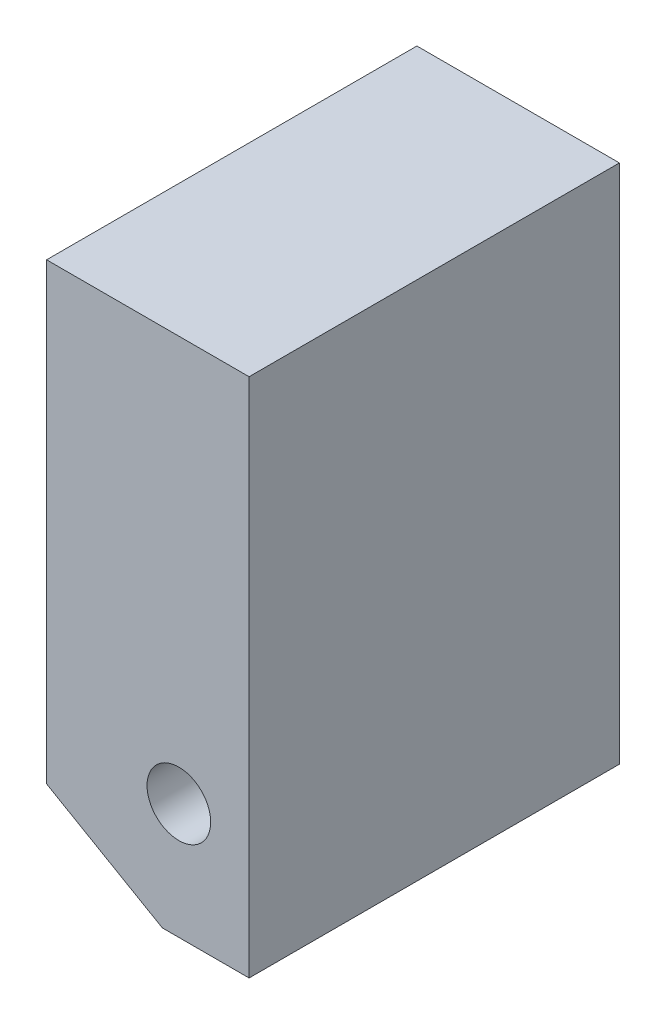
from build123d import *

# Parameters (mm, degrees)
BOSS_EXTRUDE1_DEPTH                = 32
SKETCH2_R                          = 2.75
CUT_EXTRUDE1_DEPTH                 = 42.102937625
SKETCH2_3_R                        = 2
CUT_EXTRUDE2_DEPTH                 = 11
M2_5X0_45_TAPPED_HOLE1_D           = 2.05
M2_5X0_45_TAPPED_HOLE1_DEPTH       = 7.5
M2_5X0_45_TAPPED_HOLE1_CSINK_D     = 2.55
M2_5X0_45_TAPPED_HOLE1_CSINK_ANGLE = 90
M2_5X0_45_TAPPED_HOLE1_TIP         = 0.615882135


with BuildPart() as part:
    # Sketch1 → Boss-Extrude1 (new body)
    with BuildSketch(Plane.XY):
        Polygon((-8.150210739, -18.26881255), (1.849789261, -24.042315242), (9.349789261, -24.042315242), (9.349789261, 20.957684758), (-8.150210739, 20.957684758), align=None)
    extrude(amount=BOSS_EXTRUDE1_DEPTH)

    # Sketch2 → Cut-Extrude1 (cut, through all)
    with BuildSketch(Plane(origin=(0, 0, 0), x_dir=(-1, 0, 0), z_dir=(0, 0, -1))):
        with Locations((-3.279789261, -14.042315242)):
            Circle(SKETCH2_R)
    extrude(amount=-CUT_EXTRUDE1_DEPTH, mode=Mode.SUBTRACT)

    # Sketch2<3> → Cut-Extrude2 (cut)
    with BuildSketch(Plane(origin=(0, 0, 0), x_dir=(-1, 0, 0), z_dir=(0, 0, -1))):
        with Locations((-3.279789261, -20.392315242)):
            Circle(SKETCH2_3_R)
    extrude(amount=-CUT_EXTRUDE2_DEPTH, mode=Mode.SUBTRACT)

    # M2.5x0.45 Tapped Hole1
    with Locations(Plane(origin=(0, -24.042315242, 0), x_dir=(-1, 0, 0), z_dir=(0, -1, 0))):
        with Locations((-5.599789261, -16)):
            CounterSinkHole(M2_5X0_45_TAPPED_HOLE1_D / 2, M2_5X0_45_TAPPED_HOLE1_CSINK_D / 2, depth=M2_5X0_45_TAPPED_HOLE1_DEPTH, counter_sink_angle=M2_5X0_45_TAPPED_HOLE1_CSINK_ANGLE)
            with Locations((0, 0, -(M2_5X0_45_TAPPED_HOLE1_DEPTH + M2_5X0_45_TAPPED_HOLE1_TIP / 2))):  # 118° drill point
                Cone(0, M2_5X0_45_TAPPED_HOLE1_D / 2, M2_5X0_45_TAPPED_HOLE1_TIP, mode=Mode.SUBTRACT)


solid = part.part
